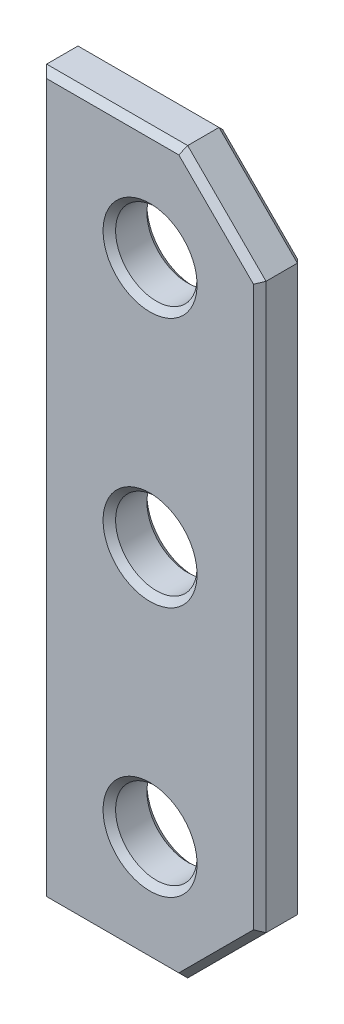
from build123d import *

# Parameters (mm, degrees)
SKETCH_1_R        = 13
EXTRUDE_434_DEPTH = 14
CHAMFER_1_SIZE    = 2


with BuildPart() as part:
    # 草图1 → Extrude 434 (new body)
    with BuildSketch(Plane.XY):
        Polygon((0, 0), (45, 0), (70, 25), (70, 205), (45, 230), (0, 230), align=None)
        with Locations((35, 35)):
            Circle(SKETCH_1_R, mode=Mode.SUBTRACT)
        with Locations((35, 115)):
            Circle(SKETCH_1_R, mode=Mode.SUBTRACT)
        with Locations((35, 195)):
            Circle(SKETCH_1_R, mode=Mode.SUBTRACT)
    extrude(amount=EXTRUDE_434_DEPTH)

    # 倒角1
    chamfer_1_edges = [part.edges().sort_by_distance(p)[0] for p in [
        (22, 195, 0),
        (22, 35, 0),
        (22.5, 0, 0),
        (57.5, 12.5, 0),
        (70, 115, 0),
        (57.5, 217.5, 0),
        (22.5, 230, 0),
        (0, 115, 0),
        (22, 115, 0),
        (22, 195, 14),
        (22, 35, 14),
        (22.5, 230, 14),
        (57.5, 217.5, 14),
        (70, 115, 14),
        (57.5, 12.5, 14),
        (22.5, 0, 14),
        (0, 115, 14),
        (22, 115, 14),
    ]]
    chamfer(chamfer_1_edges, length=CHAMFER_1_SIZE)


solid = part.part
